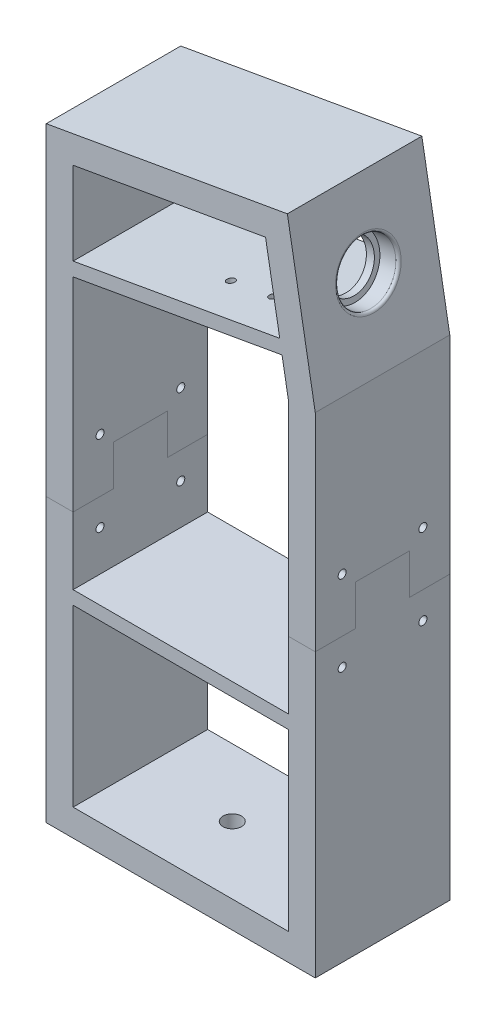
from build123d import *

# Parameters (mm, degrees)
BOSS_EXTRUDE1_DEPTH    = 50
SKETCH4_R              = 11.025
CUT_EXTRUDE1_DEPTH     = 7
SKETCH5_R              = 9
CUT_EXTRUDE2_DEPTH     = 7
BOSS_EXTRUDE2_DEPTH    = 50
SKETCH8_R              = 5
CUT_EXTRUDE3_DEPTH     = 10
CUT_EXTRUDE4_REACH     = 278.388
SKETCH9_R              = 1.485
SKETCH10_R             = 3.425
CUT_EXTRUDE5_DEPTH     = 10
SKETCH11_W             = 80
SKETCH11_H             = 5
BOSS_EXTRUDE3_DEPTH    = 50
FILLET1_R              = 1
SKETCH14_R             = 1.5
CUT_EXTRUDE6_DEPTH     = 266.502494397
SPLIT1_SURFACE_1_BACK  = 266.502
SPLIT1_SURFACE_1_DEPTH = 533.004
SPLIT1_SURFACE_2_BACK  = 266.502
SPLIT1_SURFACE_2_DEPTH = 533.004


with BuildPart() as part:
    # Sketch2 → Boss-Extrude1 (new body)
    with BuildSketch(Plane.XY):
        Polygon((-50, 225.01), (-50, 0), (50, 0), (50, 182.01), (39.631197958, 240.814398513), align=None)
        Polygon((-40, 216.619003688), (-40, 10), (40, 10), (40, 181.135113365), (31.519602204, 229.229839206), align=None, mode=Mode.SUBTRACT)
    extrude(amount=BOSS_EXTRUDE1_DEPTH)

    # Sketch4 → Cut-Extrude1 (cut)
    with BuildSketch(Plane(origin=(79.617858663, 14.038776629, 0), x_dir=(0, 0, -1), z_dir=(0.9848077530122079, 0.17364817766693136, 0))):
        with Locations((-25, 200.891001389)):
            Circle(SKETCH4_R)
    extrude(amount=-CUT_EXTRUDE1_DEPTH, mode=Mode.SUBTRACT)

    # Sketch5 → Cut-Extrude2 (cut)
    with BuildSketch(Plane(origin=(72.724204392, 12.823239385, 0), x_dir=(0, 0, -1), z_dir=(0.9848077530122079, 0.17364817766693136, 0))):
        with Locations((-25, 200.891001389)):
            Circle(SKETCH5_R)
    extrude(amount=-CUT_EXTRUDE2_DEPTH, mode=Mode.SUBTRACT)

    # Sketch7 → Boss-Extrude2 (add)
    with BuildSketch(Plane.XY.offset(50)):
        Polygon((36.795033842, 199.31137967), (37.66327473, 194.387340905), (-40, 180.69321016), (-40, 185.770343219), align=None)
    extrude(amount=-BOSS_EXTRUDE2_DEPTH)

    # Sketch8 → Cut-Extrude3 (cut)
    with BuildSketch(Plane.ZY.offset(50)):
        with Locations((25, 204.163858422)):
            Circle(SKETCH8_R)
    extrude(amount=-CUT_EXTRUDE3_DEPTH, mode=Mode.SUBTRACT)

    # Sketch9 → Cut-Extrude4 (cut, up to next)
    with BuildSketch(Plane(origin=(123.233920299, 209.475754475, 0), x_dir=(-0.9848077530122079, -0.17364817766693152, 0), z_dir=(-0.17364817766693152, 0.9848077530122079, 0)), mode=Mode.PRIVATE) as cut_extrude4_sk1:
        with Locations((104.969193438, 15.4)):
            Circle(SKETCH9_R)
    cut_extrude4_tool1 = extrude(cut_extrude4_sk1.sketch, amount=CUT_EXTRUDE4_REACH, mode=Mode.PRIVATE) & part.part
    # Sketch9 → Cut-Extrude4 (cut, up to next)
    with BuildSketch(Plane(origin=(123.233920299, 209.475754475, 0), x_dir=(-0.9848077530122079, -0.17364817766693152, 0), z_dir=(-0.17364817766693152, 0.9848077530122079, 0)), mode=Mode.PRIVATE) as cut_extrude4_sk2:
        with Locations((104.969193438, 34.6)):
            Circle(SKETCH9_R)
    cut_extrude4_tool2 = extrude(cut_extrude4_sk2.sketch, amount=CUT_EXTRUDE4_REACH, mode=Mode.PRIVATE) & part.part
    # Sketch9 → Cut-Extrude4 (cut, up to next)
    with BuildSketch(Plane(origin=(123.233920299, 209.475754475, 0), x_dir=(-0.9848077530122079, -0.17364817766693152, 0), z_dir=(-0.17364817766693152, 0.9848077530122079, 0)), mode=Mode.PRIVATE) as cut_extrude4_sk3:
        with Locations((120.969193438, 34.6)):
            Circle(SKETCH9_R)
    cut_extrude4_tool3 = extrude(cut_extrude4_sk3.sketch, amount=CUT_EXTRUDE4_REACH, mode=Mode.PRIVATE) & part.part
    # Sketch9 → Cut-Extrude4 (cut, up to next)
    with BuildSketch(Plane(origin=(123.233920299, 209.475754475, 0), x_dir=(-0.9848077530122079, -0.17364817766693152, 0), z_dir=(-0.17364817766693152, 0.9848077530122079, 0)), mode=Mode.PRIVATE) as cut_extrude4_sk4:
        with Locations((120.969193438, 15.4)):
            Circle(SKETCH9_R)
    cut_extrude4_tool4 = extrude(cut_extrude4_sk4.sketch, amount=CUT_EXTRUDE4_REACH, mode=Mode.PRIVATE) & part.part
    add(cut_extrude4_tool1.solids().sort_by_distance((19.859445, 191.248045, 15.4))[0], mode=Mode.SUBTRACT)
    add(cut_extrude4_tool2.solids().sort_by_distance((19.859445, 191.248045, 34.6))[0], mode=Mode.SUBTRACT)
    add(cut_extrude4_tool3.solids().sort_by_distance((4.102521, 188.469674, 34.6))[0], mode=Mode.SUBTRACT)
    add(cut_extrude4_tool4.solids().sort_by_distance((4.102521, 188.469674, 15.4))[0], mode=Mode.SUBTRACT)

    # Sketch10 → Cut-Extrude5 (cut)
    with BuildSketch(Plane(origin=(0, 10, 0), x_dir=(1, 0, 0), z_dir=(0, 1, 0))):
        with Locations((-5.851287133, -25)):
            Circle(SKETCH10_R)
        with Locations((24.130974018, -25)):
            Circle(SKETCH10_R)
    extrude(amount=-CUT_EXTRUDE5_DEPTH, mode=Mode.SUBTRACT)

    # Sketch11 → Boss-Extrude3 (add)
    with BuildSketch(Plane.XY.offset(50)):
        with Locations((0, 77.5)):
            Rectangle(SKETCH11_W, SKETCH11_H)
    extrude(amount=-BOSS_EXTRUDE3_DEPTH)

    # Fillet1
    fillet1_edges = [part.edges().sort_by_distance(p)[0] for p in [
        (44.733502362, 211.877792306, 36.025),
    ]]
    fillet(fillet1_edges, radius=FILLET1_R)

    # Sketch14 → Cut-Extrude6 (cut, through all)
    with BuildSketch(Plane.ZY.offset(50)):
        with Locations((40, 125)):
            Circle(SKETCH14_R)
        with Locations((40, 95)):
            Circle(SKETCH14_R)
        with Locations((10, 95)):
            Circle(SKETCH14_R)
        with Locations((10, 125)):
            Circle(SKETCH14_R)
    extrude(amount=-CUT_EXTRUDE6_DEPTH, mode=Mode.SUBTRACT)


with BuildPart() as body_2:
    # Split1: the piece behind the surface
    add(part.part)
    # Split1 surface: a surface, the sketch's curves swept straight by 533.004 mm
    with BuildLine(Plane.ZY.offset(50).offset(-SPLIT1_SURFACE_1_BACK), mode=Mode.PRIVATE) as split1_surface_1_path:
        Line((0, 105), (15, 105))
        Line((15, 105), (15, 120))
        Line((15, 120), (35, 120))
        Line((35, 120), (35, 105))
        Line((35, 105), (50, 105))
    split1_surface_1 = Shell.extrude(split1_surface_1_path.wire(), (-1 * SPLIT1_SURFACE_1_DEPTH, 0 * SPLIT1_SURFACE_1_DEPTH, 0 * SPLIT1_SURFACE_1_DEPTH))
    split(bisect_by=split1_surface_1, keep=Keep.BOTTOM)


with BuildPart() as part_1:
    add(part.part)

    # Split1: split by a surface, the side it looks to stays
    # Split1 surface: a surface, the sketch's curves swept straight by 533.004 mm
    with BuildLine(Plane.ZY.offset(50).offset(-SPLIT1_SURFACE_2_BACK), mode=Mode.PRIVATE) as split1_surface_2_path:
        Line((0, 105), (15, 105))
        Line((15, 105), (15, 120))
        Line((15, 120), (35, 120))
        Line((35, 120), (35, 105))
        Line((35, 105), (50, 105))
    split1_surface_2 = Shell.extrude(split1_surface_2_path.wire(), (-1 * SPLIT1_SURFACE_2_DEPTH, 0 * SPLIT1_SURFACE_2_DEPTH, 0 * SPLIT1_SURFACE_2_DEPTH))
    split(bisect_by=split1_surface_2, keep=Keep.TOP)


solid = Compound([body_2.part, part_1.part])
